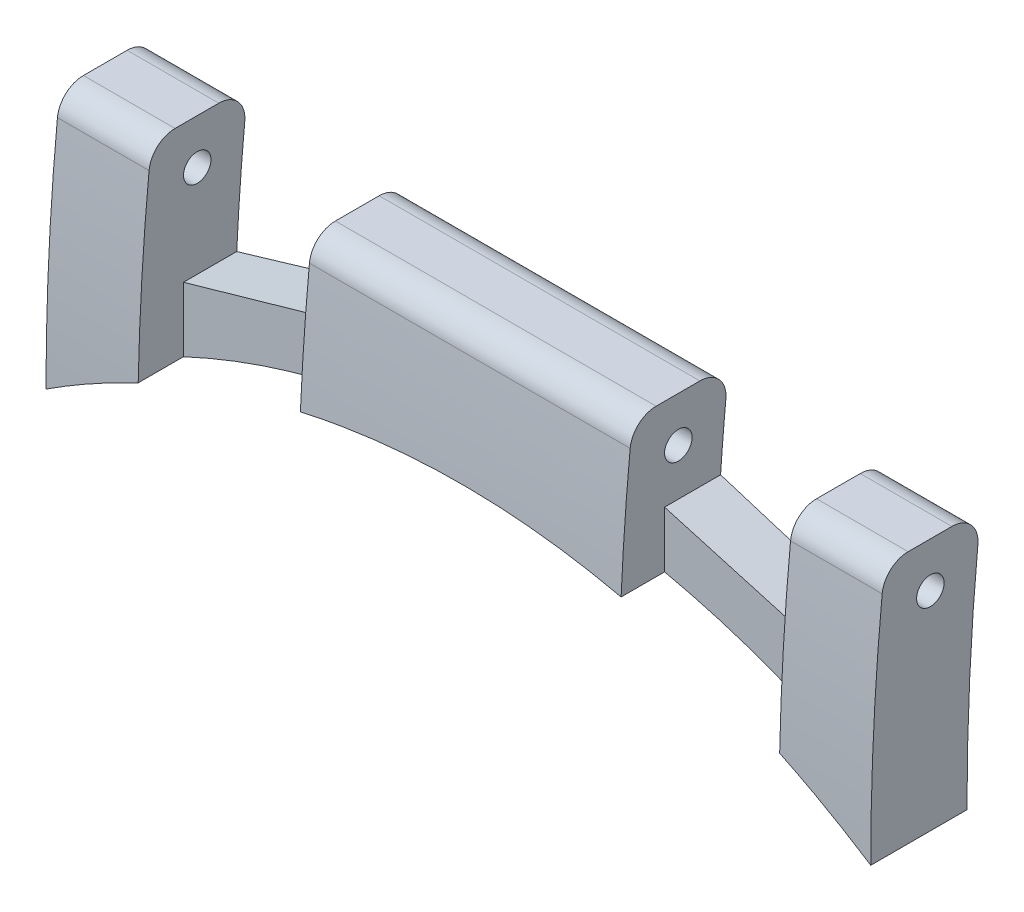
from build123d import *

# Parameters (mm, degrees)
BOSS_EXTRUDE2_DEPTH = 5
SKETCH8_R           = 50
CUT_EXTRUDE6_DEPTH  = 20
SKETCH9_OUTSIDE_W   = 10.609
SKETCH9_OUTSIDE_H   = 17.306
SKETCH9_OUTSIDE_R   = 50
CUT_EXTRUDE7_DEPTH  = 20
SKETCH11_W          = 2
SKETCH11_H          = 8
SKETCH11_W_2        = 7
BOSS_EXTRUDE4_DEPTH = 2
CUT_EXTRUDE8_DEPTH  = 18
SKETCH13_R          = 0.3
CUT_EXTRUDE10_DEPTH = 20.940160481
SKETCH14_R          = 0.3
CUT_EXTRUDE11_DEPTH = 20
FILLET1_R           = 0.57
SKETCH15_R          = 16.5
CUT_EXTRUDE12_DEPTH = 20.940160481
SKETCH16_W          = 3.5
SKETCH16_H          = 4.171301815
SKETCH16_H_2        = 4.584730653
CUT_EXTRUDE14_DEPTH = 3.5


# Read off the part's stored shape, not the designer's step: Cut-Extrude8
with BuildPart() as part:
    # Sketch1 → Boss-Extrude2 (new body)
    with BuildSketch(Plane.XY):
        Polygon((0, 0), (0, 8), (2, 8), (2, 5), (5.5, 6), (5.5, 8), (12.5, 8), (12.5, 6), (16, 5), (16, 8), (18, 8), (18, 0), (16, 0), (16, -3), (12.5, -2), (12.5, 0), (5.5, 0), (5.5, -2), (2, -3), (2, 0), align=None)
    extrude(amount=BOSS_EXTRUDE2_DEPTH)

    # Sketch8 → Cut-Extrude6 (cut)
    with BuildSketch(Plane(origin=(0, 0, 0), x_dir=(0, 0, -1), z_dir=(1, 0, 0))):
        with Locations((49, 2.5)):
            Circle(SKETCH8_R)
    extrude(amount=CUT_EXTRUDE6_DEPTH, mode=Mode.SUBTRACT)

    # Sketch9 outside → Cut-Extrude7 (cut)
    with BuildSketch(Plane(origin=(0, 0, 0), x_dir=(0, 0, -1), z_dir=(1, 0, 0))):
        with Locations((-2.8485, 2.5)):
            Rectangle(SKETCH9_OUTSIDE_W, SKETCH9_OUTSIDE_H)
        with Locations((47.1, 2.5)):
            Circle(SKETCH9_OUTSIDE_R, mode=Mode.SUBTRACT)
    extrude(amount=CUT_EXTRUDE7_DEPTH, mode=Mode.SUBTRACT)

    # Sketch11 → Boss-Extrude4 (add)
    with BuildSketch(Plane.XY.offset(4)):
        with Locations((1, 4)):
            Rectangle(SKETCH11_W, SKETCH11_H)
        with Locations((9, 4)):
            Rectangle(SKETCH11_W_2, SKETCH11_H)
        with Locations((17, 4)):
            Rectangle(SKETCH11_W, SKETCH11_H)
    extrude(amount=-BOSS_EXTRUDE4_DEPTH)

    # Cut-Extrude8 outline → Cut-Extrude8 (cut)
    with BuildSketch(Plane(origin=(0, 0, 0), x_dir=(0, 0, -1), z_dir=(1, 0, 0))):
        with BuildLine():
            Line((-4, 0), (-3.037460889, 0))
            ThreePointArc((-3.037460889, 0), (-3.07734981, 4.004827558), (-2.796579359, 8))
            Line((-2.796579359, 8), (-4, 8))
            Line((-4, 8), (-4, 0))
        make_face()
    extrude(amount=CUT_EXTRUDE8_DEPTH, mode=Mode.SUBTRACT)

    # Sketch13 → Cut-Extrude10 (cut, through all)
    with BuildSketch(Plane(origin=(0, 0, 0), x_dir=(0, 0, -1), z_dir=(1, 0, 0))):
        with Locations(Location((-1.799307082, 7.02, 0), (0, 0, 270))):
            Circle(SKETCH13_R)
    extrude(amount=CUT_EXTRUDE10_DEPTH, mode=Mode.SUBTRACT)

    # Sketch14 → Cut-Extrude11 (cut)
    with BuildSketch(Plane(origin=(0, 0, 0), x_dir=(0, 0, -1), z_dir=(1, 0, 0))):
        with Locations(Location((-1.865607241, -1.2, 0), (0, 0, 270))):
            Circle(SKETCH14_R)
    extrude(amount=CUT_EXTRUDE11_DEPTH, mode=Mode.SUBTRACT)

    # Fillet1
    # the kernel refuses this fillet: 0.57 mm, written as the material it takes off along each edge
    with BuildSketch(Plane(origin=(16, 0, 3.037460889), x_dir=(0, 0, -1), z_dir=(1, 0, 0))) as fillet1_piece_1:
        with BuildLine():
            CenterArc((0.545153795, 0.57), FILLET1_R, 182.237689069, 87.762310931)
            ThreePointArc((-0.02441155, 0.547744285), (-0.012956585, 0.273838681), (0, 0))
            Line((0, 0), (0.545153795, 0))
        make_face()
    extrude(amount=3.370719987, mode=Mode.SUBTRACT)
    with BuildSketch(Plane(origin=(14.71001217, 8, 2.796579359), x_dir=(0, 0, -1), z_dir=(1, 0, 0)), Plane(origin=(-1.28998783, 8, 2.796579359), x_dir=(0, 0, -1), z_dir=(1, 0, 0))) as fillet1_piece_2:
        with BuildLine():
            CenterArc((0.513045529, -0.57), FILLET1_R, 90, 84.275973917)
            ThreePointArc((-0.054112356, -0.513149909), (-0.02771814, -0.25650515), (0, 0))
            Line((0, 0), (0.513045529, 0))
        make_face()
    extrude(amount=4.57997566, mode=Mode.SUBTRACT)
    with BuildSketch(Plane(origin=(5.5, 0, 3.037460889), x_dir=(0, 0, -1), z_dir=(1, 0, 0))) as fillet1_piece_3:
        with BuildLine():
            CenterArc((0.545153795, 0.57), FILLET1_R, 182.237689069, 87.762310931)
            ThreePointArc((-0.02441155, 0.547744285), (-0.012956585, 0.273838681), (0, 0))
            Line((0, 0), (0.545153795, 0))
        make_face()
    extrude(amount=7, mode=Mode.SUBTRACT)
    with BuildSketch(Plane(origin=(4.21001217, 8, 2.796579359), x_dir=(0, 0, -1), z_dir=(1, 0, 0))) as fillet1_piece_4:
        with BuildLine():
            CenterArc((0.513045529, -0.57), FILLET1_R, 90, 84.275973917)
            ThreePointArc((-0.054112356, -0.513149909), (-0.02771814, -0.25650515), (0, 0))
            Line((0, 0), (0.513045529, 0))
        make_face()
    extrude(amount=9.57997566, mode=Mode.SUBTRACT)
    with BuildSketch(Plane(origin=(-1.370719987, 0, 3.037460889), x_dir=(0, 0.9990083494743675, 0.044523226303807895), z_dir=(1, 0, 0))) as fillet1_piece_5:
        with BuildLine():
            CenterArc((0.545162753, -0.569991432), FILLET1_R, 89.685852545, 87.762310931)
            Line((-0.024272006, -0.544613193), (0, 0))
            ThreePointArc((0, 0), (0.274143997, 0.000751555), (0.548287995, 0))
        make_face()
    extrude(amount=3.370719987, mode=Mode.SUBTRACT)
    with BuildSketch(Plane(origin=(2, 0, 0.937460889), x_dir=(0, 0.9990278617443559, 0.04408323330360469), z_dir=(-1, 0, 0)), Plane(origin=(19.489241357, 0, 0.937460889), x_dir=(0, 0.9990278617443559, 0.04408323330360409), z_dir=(-1, 0, 0))) as fillet1_piece_6:
        with BuildLine():
            CenterArc((0.595706111, -0.569990001), FILLET1_R, 90.339381978, 92.187220026)
            Line((0.02626023, -0.595117444), (0, 0))
            ThreePointArc((0, 0), (0.296164915, -0.000877144), (0.592329831, 0))
        make_face()
    extrude(amount=3.489241357, mode=Mode.SUBTRACT)
    with BuildSketch(Plane(origin=(3.581343655, 8, 0.696579359), x_dir=(0, 0, 1), z_dir=(-1, 0, 0))) as fillet1_piece_7:
        with BuildLine():
            CenterArc((0.632537462, -0.57), FILLET1_R, 90, 95.594572842)
            ThreePointArc((0.065252578, -0.625568519), (0.033609947, -0.312681655), (0, 0))
            Line((0, 0), (0.632537462, 0))
        make_face()
    extrude(amount=5.16268731, mode=Mode.SUBTRACT)
    with BuildSketch(Plane(origin=(14.081343655, 8, 0.696579359), x_dir=(0, -0.9946037861150897, 0.1037463669027923), z_dir=(-1, 0, 0))) as fillet1_piece_8:
        with BuildLine():
            CenterArc((0.632547622, 0.569988725), FILLET1_R, 174.045055794, 95.594572842)
            Line((0.065623464, 0.629124155), (0, 0))
            ThreePointArc((0, 0), (0.314481268, 0.000988994), (0.628962535, 0))
        make_face()
    extrude(amount=10.16268731, mode=Mode.SUBTRACT)
    with BuildSketch(Plane(origin=(19.581343655, 8, 0.696579359), x_dir=(0, -0.9946037861150897, 0.1037463669027923), z_dir=(-1, 0, 0))) as fillet1_piece_9:
        with BuildLine():
            CenterArc((0.632547622, 0.569988725), FILLET1_R, 174.045055794, 95.594572842)
            Line((0.065623464, 0.629124155), (0, 0))
            ThreePointArc((0, 0), (0.314481268, 0.000988994), (0.628962535, 0))
        make_face()
    extrude(amount=5.16268731, mode=Mode.SUBTRACT)
    with BuildSketch(Plane(origin=(12.5, 0, 0.937460889), x_dir=(0, 0.9990278617443559, 0.04408323330360469), z_dir=(-1, 0, 0))) as fillet1_piece_10:
        with BuildLine():
            CenterArc((0.595706111, -0.569990001), FILLET1_R, 90.339381978, 92.187220026)
            Line((0.02626023, -0.595117444), (0, 0))
            ThreePointArc((0, 0), (0.296164915, -0.000877144), (0.592329831, 0))
        make_face()
    extrude(amount=7, mode=Mode.SUBTRACT)

    # Sketch15 → Cut-Extrude12 (cut, through all)
    with BuildSketch(Plane.XY):
        with Locations((9, -11.34889303)):
            Circle(SKETCH15_R)
    extrude(amount=CUT_EXTRUDE12_DEPTH, mode=Mode.SUBTRACT)

    # Sketch16 → Cut-Extrude14 (cut)
    with BuildSketch(Plane.XY.offset(5.6)):
        with Locations((3.75, 4.184345942)):
            Rectangle(SKETCH16_W, SKETCH16_H)
        with Locations((14.25, 4.391060361)):
            Rectangle(SKETCH16_W, SKETCH16_H_2)
    extrude(amount=-CUT_EXTRUDE14_DEPTH, mode=Mode.SUBTRACT)


solid = part.part
